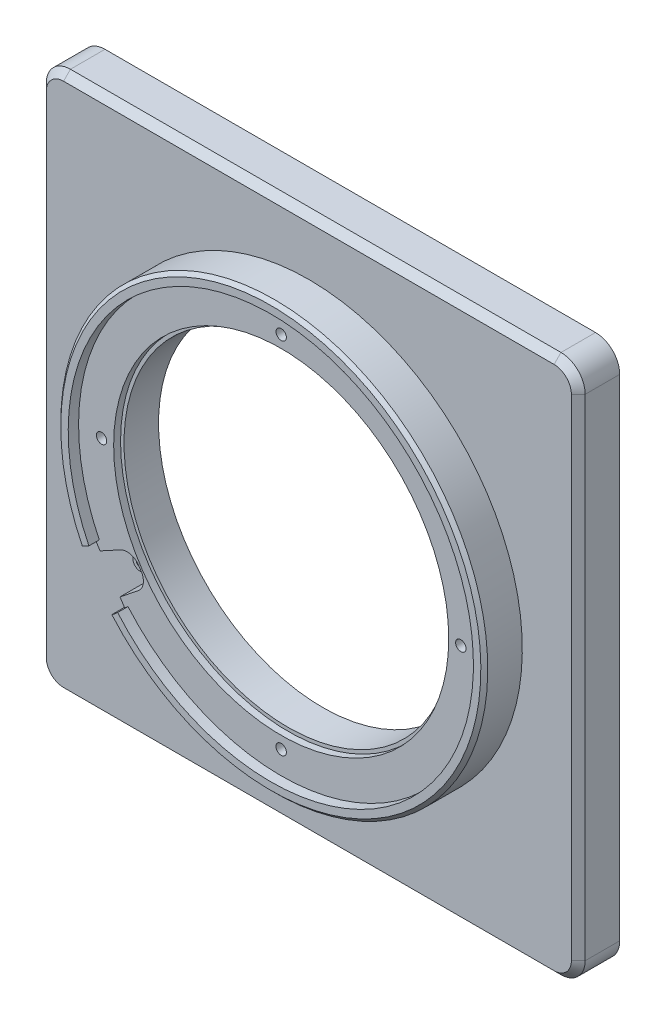
from build123d import *

# Parameters (mm, degrees)
SKETCH_1_W          = 78
SKETCH_1_H          = 78
SKETCH_1_R          = 23.75
EXTRUDE_1_DEPTH     = 2
EXTRUDE_START       = 4
SKETCH_2_R          = 30.9
SKETCH_2_R_2        = 23.75
EXTRUDE_2_DEPTH     = 4
SKETCH_3_W          = 78
SKETCH_3_H          = 78
EXTRUDE_3_DEPTH     = 4
SKETCH_4_R          = 0.75
CUT_EXTRUDE_1_DEPTH = 5
CUT_EXTRUDE_2_DEPTH = 4
SKETCH_6_R          = 1.05
SKETCH_6_R_2        = 0.55
EXTRUDE_4_DEPTH     = 2
EXTRUDE_START_2     = 1.5
EXTRUDE_5_DEPTH     = 1.5
CHAMFER_1_SIZE      = 0.5
SKETCH_9_R          = 1.65
SKETCH_9_R_2        = 0.8
EXTRUDE_6_DEPTH     = 2
CUT_EXTRUDE_START   = -2
SKETCH_9_2_R        = 0.8
CUT_EXTRUDE_4_DEPTH = 2
SKETCH_10_R         = 0.8
CUT_EXTRUDE_5_DEPTH = 4
FILLET_2_R          = 1.5
FILLET_3_R          = 3.5
CHAMFER_2_SIZE      = 1
SKETCH_11_R         = 24.25
CUT_EXTRUDE_6_DEPTH = 1
SKETCH_12_W         = 50
SKETCH_12_H         = 1
SKETCH_12_W_2       = 1
SKETCH_12_H_2       = 50
CUT_EXTRUDE_7_DEPTH = 1


with BuildPart() as part:
    # 草图1 → 凸台-拉伸1 (new body)
    with BuildSketch(Plane.XY):
        Rectangle(SKETCH_1_W, SKETCH_1_H)
        Circle(SKETCH_1_R, mode=Mode.SUBTRACT)
    extrude(amount=-EXTRUDE_1_DEPTH)

    # 草图2 → 凸台-拉伸2 (add)
    with BuildSketch(Plane.XY.offset(EXTRUDE_START)):
        Circle(SKETCH_2_R)
        Circle(SKETCH_2_R_2, mode=Mode.SUBTRACT)
    extrude(amount=-EXTRUDE_2_DEPTH)

    # 草图3 → 凸台-拉伸3 (add)
    with BuildSketch(Plane(origin=(0, 0, -2), x_dir=(-1, 0, 0), z_dir=(0, 0, -1))):
        Rectangle(SKETCH_3_W, SKETCH_3_H)
        Polygon((32, -37), (-32, -37), (-32, -32), (-37, -32), (-37, 32), (-32, 32), (-32, 37), (32, 37), (32, 32), (37, 32), (37, -32), (32, -32), align=None, mode=Mode.SUBTRACT)
    extrude(amount=EXTRUDE_3_DEPTH)

    # 草图4 → 切除-拉伸1 (cut)
    with BuildSketch(Plane.XY.offset(4)):
        with Locations((0, 26)):
            Circle(SKETCH_4_R)
        with Locations((26, 0)):
            Circle(SKETCH_4_R)
        with Locations((0, -26)):
            Circle(SKETCH_4_R)
        with Locations((-26, 0)):
            Circle(SKETCH_4_R)
    extrude(amount=-CUT_EXTRUDE_1_DEPTH, mode=Mode.SUBTRACT)

    # 草图5 → 切除-拉伸2 (cut)
    with BuildSketch(Plane.XY.offset(4)):
        with BuildLine():
            Line((-27.974819843, -13.719309558), (-23.559323961, -20.390396134))
            Line((-23.559323961, -20.390396134), (-22.644398758, -19.59853609))
            Line((-22.644398758, -19.59853609), (-23.332248508, -18.55930848))
            Line((-23.332248508, -18.55930848), (-20.696942595, -16.463091505))
            ThreePointArc((-20.696942595, -16.463091505), (-19.966595187, -15.210744122), (-20.274200224, -13.794001221))
            Line((-20.274200224, -13.794001221), (-20.619206205, -13.272754043))
            ThreePointArc((-20.619206205, -13.272754043), (-21.803134058, -12.436036561), (-23.24129537, -12.618993788))
            Line((-23.24129537, -12.618993788), (-26.200569323, -14.225748447))
            Line((-26.200569323, -14.225748447), (-26.888419073, -13.186520837))
            Line((-26.888419073, -13.186520837), (-27.974819843, -13.719309558))
        make_face()
    extrude(amount=-CUT_EXTRUDE_2_DEPTH, mode=Mode.SUBTRACT)

    # 草图6 → 凸台-拉伸4 (add)
    with BuildSketch(Plane.XY):
        with Locations((-22.409013696, -14.832202606)):
            Circle(SKETCH_6_R)
        with Locations((-22.409013696, -14.832202606)):
            Circle(SKETCH_6_R_2, mode=Mode.SUBTRACT)
    extrude(amount=EXTRUDE_4_DEPTH)

    # 草图8 → 凸台-拉伸5 (add)
    with BuildSketch(Plane.XY.offset(4).offset(EXTRUDE_START_2)):
        with BuildLine():
            ThreePointArc((30.9, 0), (-6.983586682, 30.100490312), (-27.743334437, -13.605785326))
            Line((-27.743334437, -13.605785326), (-26.888419073, -13.186520837))
            Line((-26.888419073, -13.186520837), (-26.329232439, -12.912286559))
            ThreePointArc((-26.329232439, -12.912286559), (-6.627627167, 28.56624202), (29.325, 0))
            ThreePointArc((29.325, 0), (10.240081174, -27.479016768), (-22.17347315, -19.190953949))
            Line((-22.17347315, -19.190953949), (-22.644398758, -19.59853609))
            Line((-22.644398758, -19.59853609), (-23.3643758, -20.221670146))
            ThreePointArc((-23.3643758, -20.221670146), (10.790059958, -28.954871889), (30.9, 0))
        make_face()
    extrude(amount=-EXTRUDE_5_DEPTH)

    # 倒角1
    chamfer_1_edges = [part.edges().sort_by_distance(p)[0] for p in [
        (25.767071902, 17.054852846, 5.5),
    ]]
    chamfer(chamfer_1_edges, length=CHAMFER_1_SIZE)

    # 草图9 → 凸台-拉伸6 (add)
    # profile 1 of 3: a face of its own
    with BuildSketch(Plane(origin=(0, 0, -2), x_dir=(-1, 0, 0), z_dir=(0, 0, -1))):
        with Locations((-19, -19)):
            Circle(SKETCH_9_R)
        with Locations((-19, -19)):
            Circle(SKETCH_9_R_2, mode=Mode.SUBTRACT)
    # profile 2 of 3: a face of its own
    with BuildSketch(Plane(origin=(0, 0, -2), x_dir=(-1, 0, 0), z_dir=(0, 0, -1))):
        with Locations((-19, 19)):
            Circle(SKETCH_9_R)
        with Locations((-19, 19)):
            Circle(SKETCH_9_R_2, mode=Mode.SUBTRACT)
    # profile 3 of 3: a face of its own
    with BuildSketch(Plane(origin=(0, 0, -2), x_dir=(-1, 0, 0), z_dir=(0, 0, -1))):
        with Locations((19, 19)):
            Circle(SKETCH_9_R)
        with Locations((19, 19)):
            Circle(SKETCH_9_R_2, mode=Mode.SUBTRACT)
    extrude(amount=EXTRUDE_6_DEPTH)

    # 草图9<2> → 切除-拉伸4 (cut)
    with BuildSketch(Plane(origin=(0, 0, -2), x_dir=(-1, 0, 0), z_dir=(0, 0, -1)).offset(CUT_EXTRUDE_START)):
        with Locations((-19, -19)):
            Circle(SKETCH_9_2_R)
        with Locations((-19, 19)):
            Circle(SKETCH_9_2_R)
        with Locations((19, 19)):
            Circle(SKETCH_9_2_R)
    extrude(amount=CUT_EXTRUDE_4_DEPTH, mode=Mode.SUBTRACT)

    # 草图10 → 切除-拉伸5 (cut)
    with BuildSketch(Plane(origin=(0, 0, -6), x_dir=(-1, 0, 0), z_dir=(0, 0, -1))):
        with Locations((-34.5, 34.5)):
            Circle(SKETCH_10_R)
        with Locations((34.5, 34.5)):
            Circle(SKETCH_10_R)
        with Locations((34.5, -34.5)):
            Circle(SKETCH_10_R)
        with Locations((-34.5, -34.5)):
            Circle(SKETCH_10_R)
    extrude(amount=-CUT_EXTRUDE_5_DEPTH, mode=Mode.SUBTRACT)

    # 圆角2
    fillet_2_edges = [part.edges().sort_by_distance(p)[0] for p in [
        (37, -32, -4),
        (32, -37, -4),
        (-32, -37, -4),
        (-32, -32, -4),
        (-37, -32, -4),
        (-37, 32, -4),
        (-32, 37, -4),
        (32, -32, -4),
        (-32, 32, -4),
        (32, 37, -4),
        (37, 32, -4),
        (32, 32, -4),
    ]]
    fillet(fillet_2_edges, radius=FILLET_2_R)

    # 圆角3
    fillet_3_edges = [part.edges().sort_by_distance(p)[0] for p in [
        (39, -39, -3),
        (-39, -39, -3),
        (-39, 39, -3),
        (39, 39, -3),
    ]]
    fillet(fillet_3_edges, radius=FILLET_3_R)

    # 倒角2
    chamfer_2_edges = [part.edges().sort_by_distance(p)[0] for p in [
        (0, -39, 0),
        (37.974873734, -37.974873734, 0),
        (-37.974873734, -37.974873734, 0),
        (39, 0, 0),
        (-39, 0, 0),
        (37.974873734, 37.974873734, 0),
        (-37.974873734, 37.974873734, 0),
        (0, 39, 0),
    ]]
    chamfer(chamfer_2_edges, length=CHAMFER_2_SIZE)

    # 草图11 → 切除-拉伸6 (cut)
    with BuildSketch(Plane.XY.offset(4)):
        Circle(SKETCH_11_R)
    extrude(amount=-CUT_EXTRUDE_6_DEPTH, mode=Mode.SUBTRACT)

    # 草图12 → 切除-拉伸7 (cut)
    with BuildSketch(Plane(origin=(0, 0, -6), x_dir=(-1, 0, 0), z_dir=(0, 0, -1))):
        with Locations((0, 37.5)):
            Rectangle(SKETCH_12_W, SKETCH_12_H)
        with Locations((37.5, 0)):
            Rectangle(SKETCH_12_W_2, SKETCH_12_H_2)
        with Locations((0, -37.5)):
            Rectangle(SKETCH_12_W, SKETCH_12_H)
        with Locations((-37.5, 0)):
            Rectangle(SKETCH_12_W_2, SKETCH_12_H_2)
    extrude(amount=-CUT_EXTRUDE_7_DEPTH, mode=Mode.SUBTRACT)


solid = part.part
